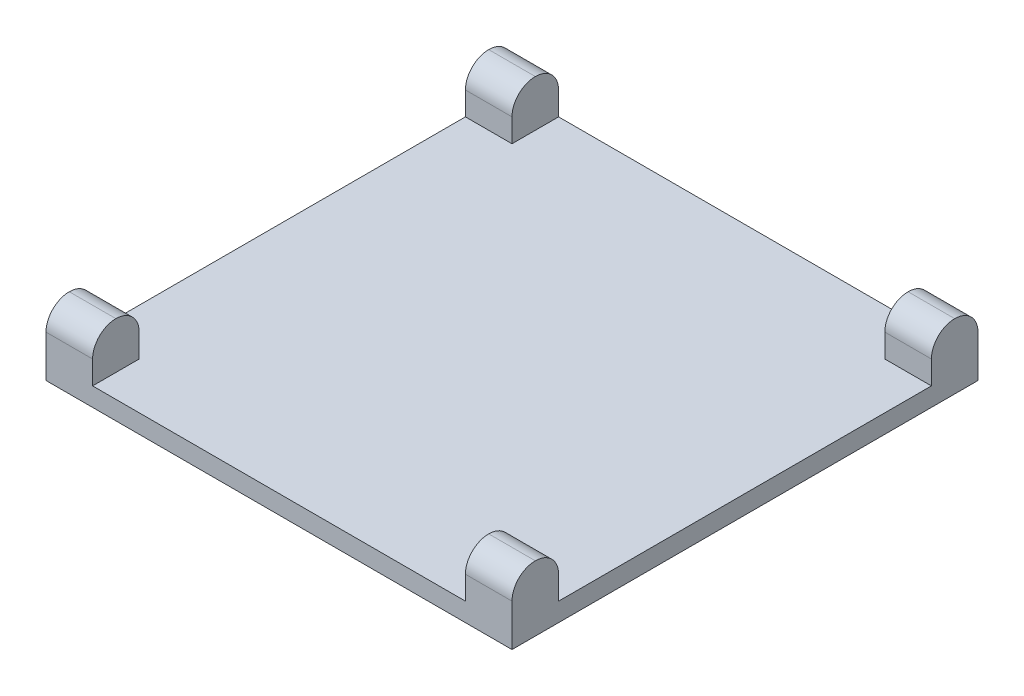
from build123d import *

# Parameters (mm, degrees)
SKETCH1_W           = 63.5
SKETCH1_H           = 63.5
BOSS_EXTRUDE1_DEPTH = 2.54
SKETCH2_W           = 6.35
SKETCH2_H           = 6.35
BOSS_EXTRUDE2_DEPTH = 6.35
FILLET1_R           = 3.175


with BuildPart() as part:
    # Sketch1 → Boss-Extrude1 (new body)
    with BuildSketch(Plane(origin=(0, 0, 0), x_dir=(1, 0, 0), z_dir=(0, 1, 0))):
        with Locations((31.75, 31.75)):
            Rectangle(SKETCH1_W, SKETCH1_H)
    extrude(amount=BOSS_EXTRUDE1_DEPTH)

    # Sketch2 → Boss-Extrude2 (add)
    with BuildSketch(Plane(origin=(0, 2.54, 0), x_dir=(1, 0, 0), z_dir=(0, 1, 0))):
        with Locations((3.175, 3.175)):
            Rectangle(SKETCH2_W, SKETCH2_H)
        with Locations((60.325, 3.175)):
            Rectangle(SKETCH2_W, SKETCH2_H)
        with Locations((3.175, 60.325)):
            Rectangle(SKETCH2_W, SKETCH2_H)
        with Locations((60.325, 60.325)):
            Rectangle(SKETCH2_W, SKETCH2_H)
    extrude(amount=BOSS_EXTRUDE2_DEPTH)

    # Fillet1
    fillet1_edges = [part.edges().sort_by_distance(p)[0] for p in [
        (3.175, 8.89, -6.35),
        (3.175, 8.89, 0),
        (60.325, 8.89, 0),
        (60.325, 8.89, -6.35),
        (60.325, 8.89, -63.5),
        (60.325, 8.89, -57.15),
        (3.175, 8.89, -63.5),
        (3.175, 8.89, -57.15),
    ]]
    fillet(fillet1_edges, radius=FILLET1_R - 0.0001)  # a hair under: the kernel refuses the full size


solid = part.part
